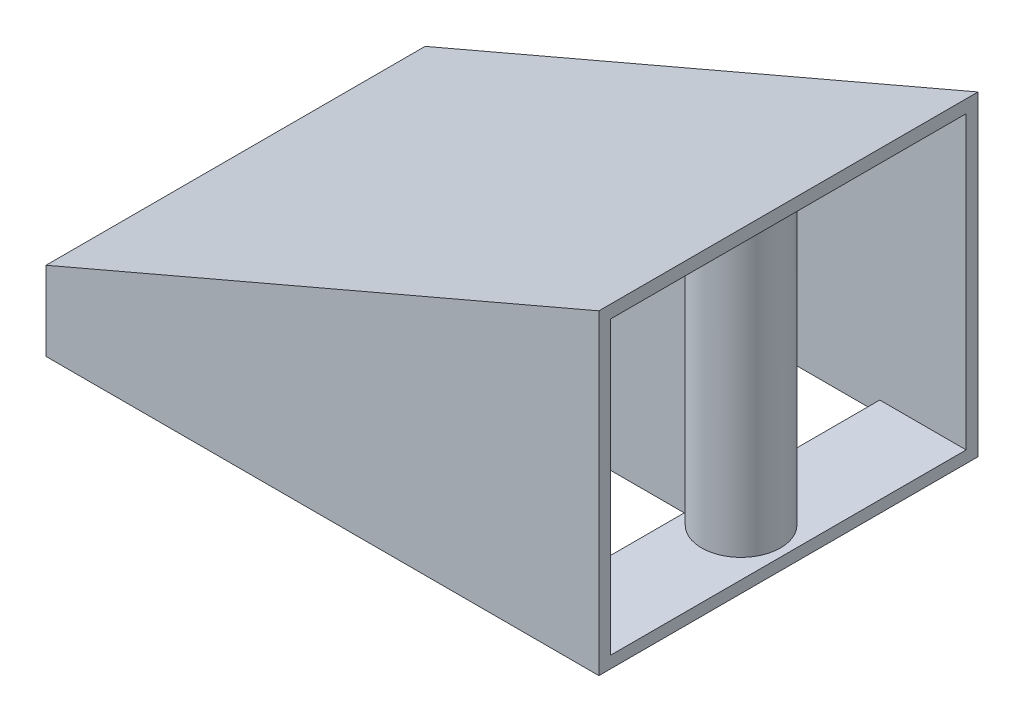
from build123d import *

# Parameters (mm, degrees)
SKETCH1_W           = 70
SKETCH1_H           = 48
BOSS_EXTRUDE1_DEPTH = 1.5
BOSS_EXTRUDE2_DEPTH = 48
BOSS_EXTRUDE3_DEPTH = 1.5
BOSS_EXTRUDE4_DEPTH = 1.5
SKETCH9_R           = 5
BOSS_EXTRUDE5_DEPTH = 50
SKETCH10_R          = 2.8
CUT_EXTRUDE1_DEPTH  = 8
BOSS_EXTRUDE7_START = -50
BOSS_EXTRUDE7_DEPTH = 48.5
CUT_EXTRUDE4_DEPTH  = 52.511197813
CUT_EXTRUDE6_DEPTH  = 1.5


# Read off the part's stored shape, not the designer's step: Boss-Extrude7
with BuildPart() as part:
    # Sketch1 → Boss-Extrude1 (new body)
    with BuildSketch(Plane(origin=(0, 0, 0), x_dir=(1, 0, 0), z_dir=(0, 1, 0))):
        with Locations((-11.991596639, -2.521008403)):
            Rectangle(SKETCH1_W, SKETCH1_H)
    extrude(amount=BOSS_EXTRUDE1_DEPTH)

    # Sketch13 → Boss-Extrude2 (add)
    with BuildSketch(Plane.XY.offset(26.521008403)):
        Polygon((-46.991596639, 10), (-46.991596639, 1.5), (-45.491596639, 1.5), (-45.491596639, 9.010905763), (23.008403361, 38.36804862), (23.008403361, 40), align=None)
    extrude(amount=-BOSS_EXTRUDE2_DEPTH)

    # Sketch14 → Boss-Extrude3 (add)
    with BuildSketch(Plane.XY.offset(26.521008403)):
        Polygon((-46.991596639, 0), (23.008403361, 0), (23.008403361, 40), (-46.991596639, 10), align=None)
    extrude(amount=-BOSS_EXTRUDE3_DEPTH)

    # Sketch15 → Boss-Extrude4 (add)
    with BuildSketch(Plane(origin=(0, 0, -21.478991597), x_dir=(-1, 0, 0), z_dir=(0, 0, -1))):
        Polygon((-23.008403361, 0), (46.991596639, 0), (46.991596639, 10), (-23.008403361, 40), align=None)
    extrude(amount=-BOSS_EXTRUDE4_DEPTH)

    # Sketch9 → Boss-Extrude5 (add)
    with BuildSketch(Plane.XZ):
        with Locations(Location((-40.991596639, 2.521008403, 0), (0, 0, 270))):
            Circle(SKETCH9_R)
        with Locations(Location((-24.991596639, 20.521008403, 0), (0, 0, 270))):
            Circle(SKETCH9_R)
        with Locations(Location((17.008403361, 2.521008403, 0), (0, 0, 270))):
            Circle(SKETCH9_R)
        with Locations(Location((-24.991596639, -15.478991597, 0), (0, 0, 270))):
            Circle(SKETCH9_R)
    extrude(amount=-BOSS_EXTRUDE5_DEPTH)

    # Sketch10 → Cut-Extrude1 (cut)
    with BuildSketch(Plane.XZ):
        with Locations(Location((-40.991596639, 2.521008403, 0), (0, 0, 270))):
            Circle(SKETCH10_R)
        with Locations(Location((-24.991596639, 20.521008403, 0), (0, 0, 270))):
            Circle(SKETCH10_R)
        with Locations(Location((-24.991596639, -15.478991597, 0), (0, 0, 270))):
            Circle(SKETCH10_R)
        with Locations(Location((17.008403361, 2.521008403, 0), (0, 0, 270))):
            Circle(SKETCH10_R)
    extrude(amount=-CUT_EXTRUDE1_DEPTH, mode=Mode.SUBTRACT)

    # Boss-Extrude7 outline → Boss-Extrude7 (add)
    with BuildSketch(Plane.XZ.offset(BOSS_EXTRUDE7_START)):
        with BuildLine():
            ThreePointArc((-21.250723923, 17.203498596), (-21.79067464, 16.679902005), (-22.403055842, 16.243221996))
            Line((-22.403055842, 16.243221996), (-13.254543259, 5.265006896))
            ThreePointArc((-13.254543259, 5.265006896), (-9.913482791, 2.687784718), (-5.794711082, 1.771008403))
            Line((-5.794711082, 1.771008403), (12.064973378, 1.771008403))
            ThreePointArc((12.064973378, 1.771008403), (12.008403361, 2.521008403), (12.064973378, 3.271008403))
            Line((12.064973378, 3.271008403), (-5.092148663, 3.271008403))
            ThreePointArc((-5.092148663, 3.271008403), (-9.210920372, 4.187784718), (-12.55198084, 6.765006896))
            Line((-12.55198084, 6.765006896), (-21.250723923, 17.203498596))
        make_face()
    extrude(amount=BOSS_EXTRUDE7_DEPTH)

    # Sketch20 → Cut-Extrude4 (cut, through all)
    with BuildSketch(Plane(origin=(-10.912489134, 25.462474645, 0), x_dir=(0.9191450300180579, 0.3939192985791677, 0), z_dir=(-0.3939192985791677, 0.9191450300180579, 0))):
        with BuildLine():
            add(Edge.make_bspline(
                [(-15.317612613, 20.478991597), (-24.739688298, 20.478991597), (-20.028650455, 12.978991597), (-15.317612613, 5.478991597), (-10.606574771, 12.978991597), (-5.895536929, 20.478991597), (-15.317612613, 20.478991597)],
                knots=[4.71238898, 4.71238898, 4.71238898, 6.806784083, 6.806784083, 8.901179185, 8.901179185, 10.995574288, 10.995574288, 10.995574288], degree=2, weights=[1, 0.5, 1, 0.5, 1, 0.5, 1]))
        make_face()
        with BuildLine():
            add(Edge.make_bspline(
                [(24.998734434, -3.271008403), (26.776327601, -14.040210809), (34.50198737, -5.780609606), (42.227647139, 2.478991597), (30.377026022, 2.478991597)],
                knots=[0.150568273, 0.150568273, 0.150568273, 2.431478627, 2.431478627, 4.71238898, 4.71238898, 4.71238898], degree=2, weights=[1, 0.417180872, 1, 0.417180872, 1]))
            add(Edge.make_bspline(
                [(30.377026022, 2.478991597), (25.700250728, 2.478991597), (24.998734434, -1.771008403)],
                knots=[4.71238898, 4.71238898, 4.71238898, 6.132617034, 6.132617034, 6.132617034], degree=2, weights=[1, 0.758287544, 1]))
            Line((24.998734434, -1.771008403), (5.567976635, -1.771008403))
            add(Edge.make_bspline(
                [(5.567976635, -1.771008403), (0.619718616, -1.771008404), (-2.548078974, -5.265006896)],
                knots=[1.570796327, 1.570796327, 1.570796327, 2.446854377, 2.446854377, 2.446854377], degree=2, weights=[1, 0.905589421, 1]))
            Line((-2.548078974, -5.265006896), (-12.50136413, -16.243221996))
            add(Edge.make_bspline(
                [(-12.50136413, -16.243221996), (-13.799875321, -15.521008403), (-15.317612613, -15.521008403)],
                knots=[4.168218977, 4.168218977, 4.168218977, 4.71238898, 4.71238898, 4.71238898], degree=2, weights=[1, 0.963212666, 1]))
            add(Edge.make_bspline(
                [(-15.317612613, -15.521008403), (-22.262261076, -15.521008403), (-20.599158718, -21.718406923), (-18.936056359, -27.915805443), (-12.787966418, -24.947503117), (-6.639876476, -21.979200791), (-11.247664353, -17.203498596)],
                knots=[4.71238898, 4.71238898, 4.71238898, 6.525015233, 6.525015233, 8.337641486, 8.337641486, 10.150267739, 10.150267739, 10.150267739], degree=2, weights=[1, 0.616652372, 1, 0.616652372, 1, 0.616652372, 1]))
            Line((-11.247664353, -17.203498596), (-1.783713835, -6.765006896))
            add(Edge.make_bspline(
                [(6.332341775, -3.271008403), (1.384083756, -3.271008404), (-1.783713835, -6.765006896)],
                knots=[1.570796327, 1.570796327, 1.570796327, 2.446854377, 2.446854377, 2.446854377], degree=2, weights=[1, 0.905589421, 1]))
            Line((6.332341775, -3.271008403), (24.998734434, -3.271008403))
        make_face()
        with BuildLine():
            add(Edge.make_bspline(
                [(-32.725093998, 2.478991597), (-42.147169682, 2.478991597), (-37.43613184, -5.021008403), (-32.725093998, -12.521008403), (-28.014056156, -5.021008403), (-23.303018313, 2.478991597), (-32.725093998, 2.478991597)],
                knots=[4.71238898, 4.71238898, 4.71238898, 6.806784083, 6.806784083, 8.901179185, 8.901179185, 10.995574288, 10.995574288, 10.995574288], degree=2, weights=[1, 0.5, 1, 0.5, 1, 0.5, 1]))
        make_face()
    extrude(amount=CUT_EXTRUDE4_DEPTH, mode=Mode.SUBTRACT)


with BuildPart() as cut_extrude4_kept_piece:
    # of the separate pieces the step leaves, the one the design keeps (cut_extrude4_pieces_kept)
    add(part.part.solids().sort_by_distance((-46.991596639, 0, -21.478991597))[0])

    # Sketch22 → Cut-Extrude6 (cut)
    with BuildSketch(Plane.XZ):
        with BuildLine():
            Line((12.064973378, 3.271008403), (12.064973378, 25.021008403))
            Line((12.064973378, 25.021008403), (-22.812147167, 25.021008403))
            ThreePointArc((-22.812147167, 25.021008403), (-20.088442695, 21.500335417), (-21.250723923, 17.203498596))
            Line((-21.250723923, 17.203498596), (-12.55198084, 6.765006896))
            ThreePointArc((-12.55198084, 6.765006896), (-9.210920372, 4.187784718), (-5.092148663, 3.271008403))
            Line((-5.092148663, 3.271008403), (12.064973378, 3.271008403))
        make_face()
        with BuildLine():
            Line((-16.991596639, -19.978991597), (12.064973378, -19.978991597))
            Line((12.064973378, -19.978991597), (12.064973378, 1.771008403))
            Line((12.064973378, 1.771008403), (-5.794711082, 1.771008403))
            ThreePointArc((-5.794711082, 1.771008403), (-9.913482791, 2.687784718), (-13.254543259, 5.265006896))
            Line((-13.254543259, 5.265006896), (-22.403055842, 16.243221996))
            ThreePointArc((-22.403055842, 16.243221996), (-29.385253712, 18.134425591), (-27.17104611, 25.021008403))
            Line((-27.17104611, 25.021008403), (-32.991596639, 25.021008403))
            ThreePointArc((-32.991596639, 25.021008403), (-34.405810201, 24.435221966), (-34.991596639, 23.021008403))
            Line((-34.991596639, 23.021008403), (-34.991596639, -7.478991597))
            ThreePointArc((-34.991596639, -7.478991597), (-34.405810201, -8.893205159), (-32.991596639, -9.478991597))
            Line((-32.991596639, -9.478991597), (-20.991596639, -9.478991597))
            ThreePointArc((-20.991596639, -9.478991597), (-19.577383076, -10.064778034), (-18.991596639, -11.478991597))
            Line((-18.991596639, -11.478991597), (-18.991596639, -17.978991597))
            ThreePointArc((-18.991596639, -17.978991597), (-18.405810201, -19.393205159), (-16.991596639, -19.978991597))
        make_face()
    extrude(amount=-CUT_EXTRUDE6_DEPTH, mode=Mode.SUBTRACT)


solid = cut_extrude4_kept_piece.part
